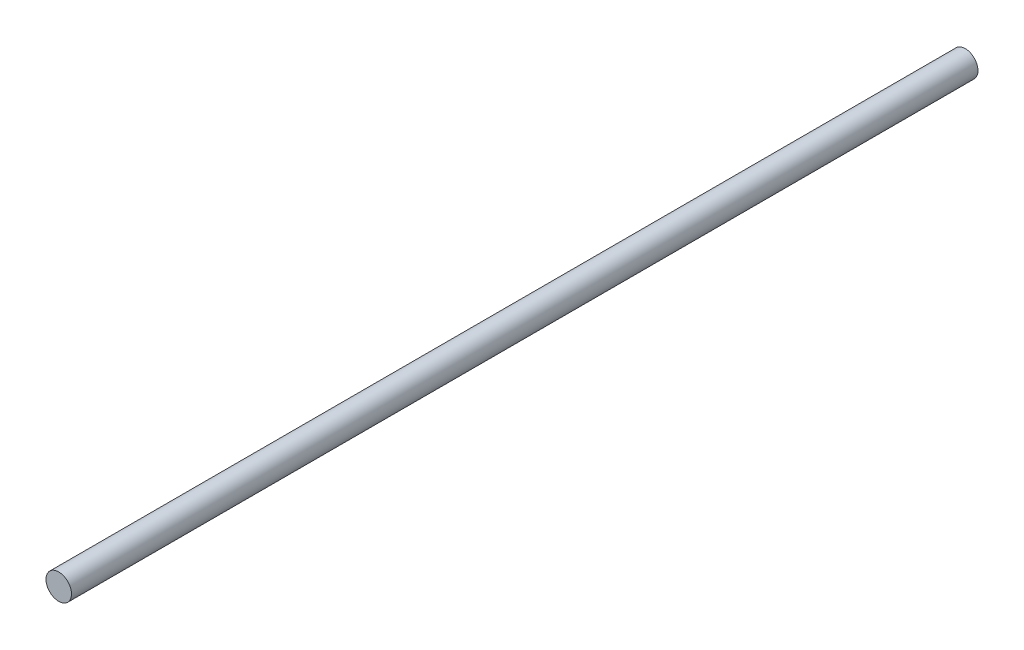
from build123d import *

# Parameters (mm, degrees)
SKETCH1_R           = 1.45
BOSS_EXTRUDE1_DEPTH = 103


with BuildPart() as part:
    # Sketch1 → Boss-Extrude1 (new body)
    with BuildSketch(Plane.XY):
        Circle(SKETCH1_R)
    extrude(amount=BOSS_EXTRUDE1_DEPTH)


solid = part.part
